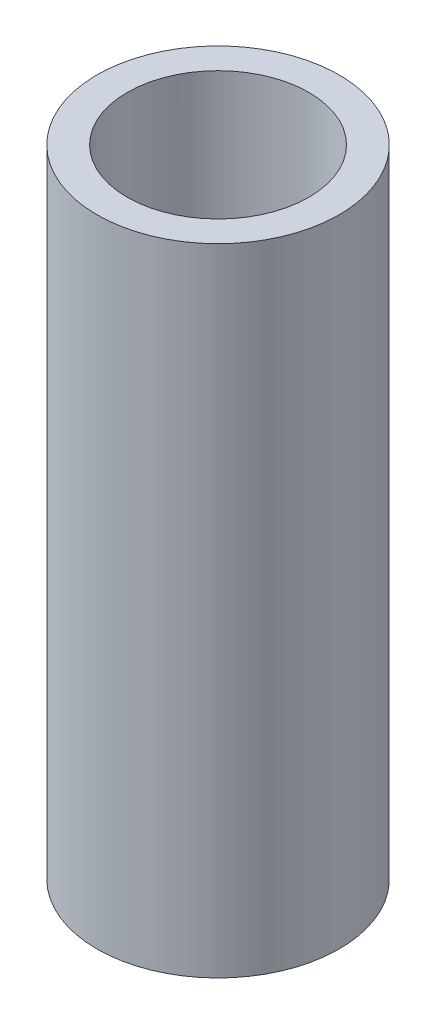
from build123d import *

# Parameters (mm, degrees)
SKETCH1_R           = 4
BOSS_EXTRUDE1_DEPTH = 21
SKETCH2_R           = 3
CUT_EXTRUDE1_DEPTH  = 10
CUT_EXTRUDE3_START  = -10
SKETCH3_R           = 3
CUT_EXTRUDE3_DEPTH  = 10


with BuildPart() as part:
    # Sketch1 → Boss-Extrude1 (new body)
    with BuildSketch(Plane(origin=(0, 0, 0), x_dir=(1, 0, 0), z_dir=(0, 1, 0))):
        with Locations(Location((0, 0, 0), (0, 0, 90))):
            Circle(SKETCH1_R)
    extrude(amount=BOSS_EXTRUDE1_DEPTH)

    # Sketch2 → Cut-Extrude1 (cut)
    with BuildSketch(Plane.XZ):
        with Locations(Location((0, 0, 0), (0, 0, 270))):
            Circle(SKETCH2_R)
    extrude(amount=-CUT_EXTRUDE1_DEPTH, mode=Mode.SUBTRACT)

    # Sketch3 → Cut-Extrude3 (cut)
    with BuildSketch(Plane(origin=(0, 21, 0), x_dir=(1, 0, 0), z_dir=(0, 1, 0)).offset(CUT_EXTRUDE3_START)):
        with Locations(Location((0, 0, 0), (0, 0, 90))):
            Circle(SKETCH3_R)
    extrude(amount=CUT_EXTRUDE3_DEPTH, mode=Mode.SUBTRACT)

    # Cut-Extrude5: read off the stored shape, not the designer's step
    # Cut-Extrude5: loft between two sections, ruled curve by curve
    cut_extrude5_from = [
        Edge.make_three_point_arc((-2.653136305, 14.6, 0), (-2.653136305, 16, 1.4), (-2.653136305, 17.4, 0)),
        Edge.make_three_point_arc((-2.653136305, 17.4, 0), (-2.653136305, 16, -1.4), (-2.653136305, 14.6, 0)),
    ]
    cut_extrude5_to = [
        Edge.make_three_point_arc((-3.999916451, 14.6, 0), (-3.999916451, 16, 1.4), (-3.999916451, 17.4, 0)),
        Edge.make_three_point_arc((-3.999916451, 17.4, 0), (-3.999916451, 16, -1.4), (-3.999916451, 14.6, 0)),
    ]
    cut_extrude5 = Solid(Shell([*[Face.make_surface_from_curves(cut_extrude5_from[k], cut_extrude5_to[k]) for k in range(2)], Face(Wire(cut_extrude5_from)), Face(Wire(cut_extrude5_to))]))
    add(cut_extrude5, mode=Mode.SUBTRACT)

    # Cut-Extrude5 2: loft between two sections, ruled curve by curve
    cut_extrude5_2_from = [
        Edge.make_three_point_arc((-2.653136305, 3.6, 0), (-2.653136305, 5, 1.4), (-2.653136305, 6.4, 0)),
        Edge.make_three_point_arc((-2.653136305, 6.4, 0), (-2.653136305, 5, -1.4), (-2.653136305, 3.6, 0)),
    ]
    cut_extrude5_2_to = [
        Edge.make_three_point_arc((-3.999916451, 3.6, 0), (-3.999916451, 5, 1.4), (-3.999916451, 6.4, 0)),
        Edge.make_three_point_arc((-3.999916451, 6.4, 0), (-3.999916451, 5, -1.4), (-3.999916451, 3.6, 0)),
    ]
    cut_extrude5_2 = Solid(Shell([*[Face.make_surface_from_curves(cut_extrude5_2_from[k], cut_extrude5_2_to[k]) for k in range(2)], Face(Wire(cut_extrude5_2_from)), Face(Wire(cut_extrude5_2_to))]))
    add(cut_extrude5_2, mode=Mode.SUBTRACT)


solid = part.part
